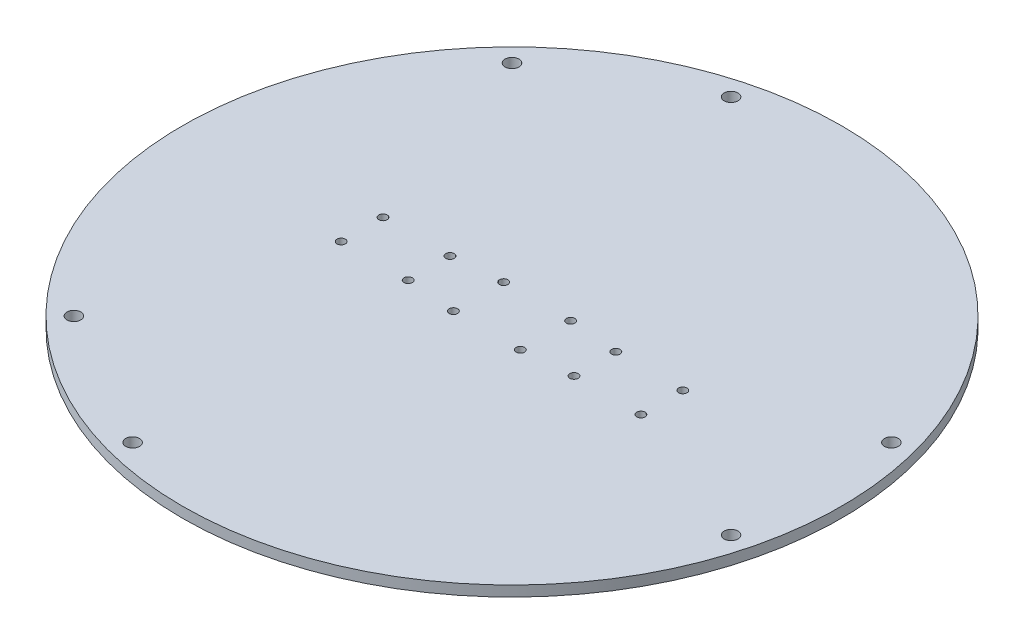
from build123d import *

# Parameters (mm, degrees)
SKETCH1_R           = 100
SKETCH1_R_2         = 1.27
SKETCH1_R_3         = 2.1
BOSS_EXTRUDE1_DEPTH = 3.175


with BuildPart() as part:
    # Sketch1 → Boss-Extrude1 (new body)
    with BuildSketch(Plane(origin=(0, 0, 0), x_dir=(1, 0, 0), z_dir=(0, 1, 0))):
        Circle(SKETCH1_R)
        with Locations((-10.16, 7.62)):
            Circle(SKETCH1_R_2, mode=Mode.SUBTRACT)
        with Locations((-10.16, -7.62)):
            Circle(SKETCH1_R_2, mode=Mode.SUBTRACT)
        with Locations((10.16, -7.62)):
            Circle(SKETCH1_R_2, mode=Mode.SUBTRACT)
        with Locations((10.16, 7.62)):
            Circle(SKETCH1_R_2, mode=Mode.SUBTRACT)
        with Locations((25.16, 6.35)):
            Circle(SKETCH1_R_2, mode=Mode.SUBTRACT)
        with Locations((25.16, -6.35)):
            Circle(SKETCH1_R_2, mode=Mode.SUBTRACT)
        with Locations((45.48, -6.35)):
            Circle(SKETCH1_R_2, mode=Mode.SUBTRACT)
        with Locations((45.48, 6.35)):
            Circle(SKETCH1_R_2, mode=Mode.SUBTRACT)
        with Locations((-45.48, 6.35)):
            Circle(SKETCH1_R_2, mode=Mode.SUBTRACT)
        with Locations((-45.48, -6.35)):
            Circle(SKETCH1_R_2, mode=Mode.SUBTRACT)
        with Locations((-25.16, -6.35)):
            Circle(SKETCH1_R_2, mode=Mode.SUBTRACT)
        with Locations((-25.16, 6.35)):
            Circle(SKETCH1_R_2, mode=Mode.SUBTRACT)
        with Locations((90.797027671, 24.32899024)):
            Circle(SKETCH1_R_3, mode=Mode.SUBTRACT)
        with Locations((90.797027671, -24.32899024)):
            Circle(SKETCH1_R_3, mode=Mode.SUBTRACT)
        with Locations((-66.468037432, 66.468037432)):
            Circle(SKETCH1_R_3, mode=Mode.SUBTRACT)
        with Locations((-24.32899024, 90.797027671)):
            Circle(SKETCH1_R_3, mode=Mode.SUBTRACT)
        with Locations((-24.32899024, -90.797027671)):
            Circle(SKETCH1_R_3, mode=Mode.SUBTRACT)
        with Locations((-66.468037432, -66.468037432)):
            Circle(SKETCH1_R_3, mode=Mode.SUBTRACT)
    extrude(amount=BOSS_EXTRUDE1_DEPTH)


solid = part.part
